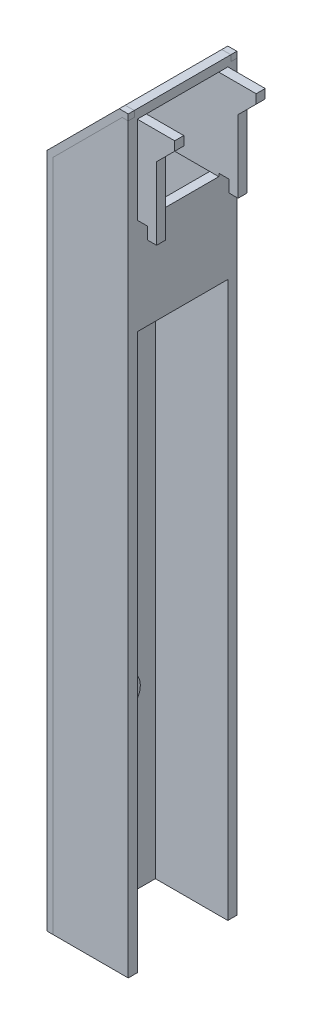
from build123d import *

# Parameters (mm, degrees)
SKETCH1_W            = 1.5
SKETCH1_H            = 92
BOSS_EXTRUDE1_DEPTH  = 12
BOSS_EXTRUDE5_DEPTH  = 1.5
BOSS_EXTRUDE6_START  = 12
SKETCH1_7_W          = 1.5
SKETCH1_7_H          = 15
BOSS_EXTRUDE6_DEPTH  = 15.2
BOSS_EXTRUDE3_START  = 12
SKETCH1_4_W          = 18
SKETCH1_4_H          = 124
SKETCH1_4_R          = 1
BOSS_EXTRUDE3_DEPTH  = 1.5
BOSS_EXTRUDE4_START  = 10
SKETCH1_5_R          = 3
SKETCH1_5_R_2        = 1
BOSS_EXTRUDE4_DEPTH  = 2
BOSS_EXTRUDE12_START = -3.2
SKETCH1_9_W          = 1.5
SKETCH1_9_H          = 1.5
BOSS_EXTRUDE12_DEPTH = 3
SKETCH4_W            = 1.5
SKETCH4_H            = 1.5
BOSS_EXTRUDE10_DEPTH = 1.5
SKETCH4_4_W          = 1.7
SKETCH4_4_H          = 1.5
CUT_EXTRUDE5_DEPTH   = 0.5
CHAMFER1_SIZE        = 12
CHAMFER2_SIZE        = 1.5
CUT_EXTRUDE1_START   = -1
CUT_EXTRUDE1_DEPTH   = 1
CUT_EXTRUDE2_START   = -18
CUT_EXTRUDE2_DEPTH   = 1
BOSS_EXTRUDE7_DEPTH  = 1
BOSS_EXTRUDE8_START  = -18
BOSS_EXTRUDE8_DEPTH  = 1
CHAMFER3_SIZE        = 3


# Read off the part's stored shape, not the designer's step: Cut-Extrude1, Cut-Extrude2
with BuildPart() as part:
    # Sketch1 → Boss-Extrude1 (new body)
    with BuildSketch(Plane.ZY):
        Polygon((-1176.487890925, 3.687580965), (-1176.487890925, 19.187580965), (-1176.487890925, 32.687580965), (-1176.487890925, 34.187580965), (-1174.987890925, 34.187580965), (-1162.987890925, 34.187580965), (-1161.487890925, 34.187580965), (-1161.487890925, 32.687580965), (-1161.487890925, 19.187580965), (-1161.487890925, 3.687580965), (-1159.987890925, 3.687580965), (-1159.987890925, 35.687580965), (-1177.987890925, 35.687580965), (-1177.987890925, 3.687580965), align=None)
        with Locations((-1160.737890925, -42.312419035)):
            Rectangle(SKETCH1_W, SKETCH1_H)
        with Locations((-1177.237890925, -42.312419035)):
            Rectangle(SKETCH1_W, SKETCH1_H)
    extrude(amount=BOSS_EXTRUDE1_DEPTH)

    # Sketch1<6> → Boss-Extrude5 (add)
    with BuildSketch(Plane.ZY):
        Polygon((-1174.987890925, 19.187580965), (-1176.487890925, 19.187580965), (-1176.487890925, 3.687580965), (-1161.487890925, 3.687580965), (-1161.487890925, 19.187580965), (-1162.987890925, 19.187580965), align=None)
    extrude(amount=BOSS_EXTRUDE5_DEPTH)

    # Sketch1<7> → Boss-Extrude6 (add)
    with BuildSketch(Plane.ZY.offset(BOSS_EXTRUDE6_START)):
        with Locations((-1175.737890925, 26.687580965)):
            Rectangle(SKETCH1_7_W, SKETCH1_7_H)
        with Locations((-1162.237890925, 26.687580965)):
            Rectangle(SKETCH1_7_W, SKETCH1_7_H)
    extrude(amount=-BOSS_EXTRUDE6_DEPTH)

    # Sketch1<4> → Boss-Extrude3 (add)
    with BuildSketch(Plane.ZY.offset(BOSS_EXTRUDE3_START)):
        with Locations((-1168.987890925, -26.312419035)):
            Rectangle(SKETCH1_4_W, SKETCH1_4_H)
        with Locations(Location((-1168.987890925, -57.312419035, 0), (0, 0, 180))):
            Circle(SKETCH1_4_R, mode=Mode.SUBTRACT)
    extrude(amount=BOSS_EXTRUDE3_DEPTH)

    # Sketch1<5> → Boss-Extrude4 (add)
    with BuildSketch(Plane.ZY.offset(BOSS_EXTRUDE4_START)):
        with Locations(Location((-1168.987890925, -57.312419035, 0), (0, 0, 180))):
            Circle(SKETCH1_5_R)
        with Locations(Location((-1168.987890925, -57.312419035, 0), (0, 0, 180))):
            Circle(SKETCH1_5_R_2, mode=Mode.SUBTRACT)
    extrude(amount=BOSS_EXTRUDE4_DEPTH)

    # Sketch1<9> → Boss-Extrude12 (add)
    with BuildSketch(Plane.ZY.offset(BOSS_EXTRUDE12_START)):
        with Locations((-1162.237890925, 33.437580965)):
            Rectangle(SKETCH1_9_W, SKETCH1_9_H)
        with Locations((-1175.737890925, 33.437580965)):
            Rectangle(SKETCH1_9_W, SKETCH1_9_H)
    extrude(amount=-BOSS_EXTRUDE12_DEPTH)

    # Sketch4 → Boss-Extrude10 (add)
    with BuildSketch(Plane.XZ.offset(-19.187580965)):
        with Locations((2.45, -1162.237890925)):
            Rectangle(SKETCH4_W, SKETCH4_H)
        with Locations((2.45, -1175.737890925)):
            Rectangle(SKETCH4_W, SKETCH4_H)
    extrude(amount=BOSS_EXTRUDE10_DEPTH)

    # Sketch4<4> → Cut-Extrude5 (cut)
    with BuildSketch(Plane.XZ.offset(-19.187580965)):
        with Locations((0.85, -1162.237890925)):
            Rectangle(SKETCH4_4_W, SKETCH4_4_H)
        with Locations((0.85, -1175.737890925)):
            Rectangle(SKETCH4_4_W, SKETCH4_4_H)
    extrude(amount=-CUT_EXTRUDE5_DEPTH, mode=Mode.SUBTRACT)

    # Chamfer1
    chamfer1_edges = [part.edges().sort_by_distance(p)[0] for p in [
        (-12, 34.187580965, -1168.987890925),
        (-13.5, 35.687580965, -1168.987890925),
    ]]
    chamfer(chamfer1_edges, length=CHAMFER1_SIZE - 0.0001)  # a hair under: the kernel refuses the full size

    # Chamfer2
    chamfer2_edges = [part.edges().sort_by_distance(p)[0] for p in [
        (-6.75, 19.187580965, -1176.487890925),
        (-6.75, 19.187580965, -1161.487890925),
    ]]
    chamfer(chamfer2_edges, length=CHAMFER2_SIZE - 0.0001)  # a hair under: the kernel refuses the full size

    # Cut-Extrude1 outline → Cut-Extrude1 (cut)
    with BuildSketch(Plane.XY.offset(-1159.987890925).offset(CUT_EXTRUDE1_START)):
        Polygon((-12.5, 23.187580965), (-1, 34.687580965), (1, 34.687580965), (1, 37), (-15, 37), (-15, -88.312419035), (-12.5, -88.312419035), align=None)
    extrude(amount=CUT_EXTRUDE1_DEPTH, mode=Mode.SUBTRACT)

    # Cut-Extrude2 outline → Cut-Extrude2 (cut)
    with BuildSketch(Plane.XY.offset(-1159.987890925).offset(CUT_EXTRUDE2_START)):
        Polygon((-1, 34.687580965), (1, 34.687580965), (1, 37), (-15, 37), (-15, -88.312419035), (-12.5, -88.312419035), (-12.5, 23.187580965), align=None)
    extrude(amount=CUT_EXTRUDE2_DEPTH, mode=Mode.SUBTRACT)

    # Chamfer3
    chamfer3_edges = [part.edges().sort_by_distance(p)[0] for p in [
        (3.2, 32.687580965, -1175.737890925),
        (3.2, 32.687580965, -1162.237890925),
    ]]
    chamfer(chamfer3_edges, length=CHAMFER3_SIZE - 0.0001)  # a hair under: the kernel refuses the full size


with BuildPart() as body_2:
    # Sketch2<2> → Boss-Extrude7 (new body)
    with BuildSketch(Plane.XY.offset(-1159.987890925)):
        Polygon((0, 35.687580965), (-1.5, 35.687580965), (-13.5, 23.687580965), (-13.5, -88.312419035), (-12.5, -88.312419035), (-12.5, 23.187580965), (-1, 34.687580965), (0, 34.687580965), align=None)
    extrude(amount=-BOSS_EXTRUDE7_DEPTH)


with BuildPart() as body_3:
    # Sketch2<5> → Boss-Extrude8 (new body)
    with BuildSketch(Plane.XY.offset(-1159.987890925).offset(BOSS_EXTRUDE8_START)):
        Polygon((0, 35.687580965), (-1.5, 35.687580965), (-13.5, 23.687580965), (-13.5, -88.312419035), (-12.5, -88.312419035), (-12.5, 23.187580965), (-1, 34.687580965), (0, 34.687580965), align=None)
    extrude(amount=BOSS_EXTRUDE8_DEPTH)


solid = Compound([part.part, body_2.part, body_3.part])
